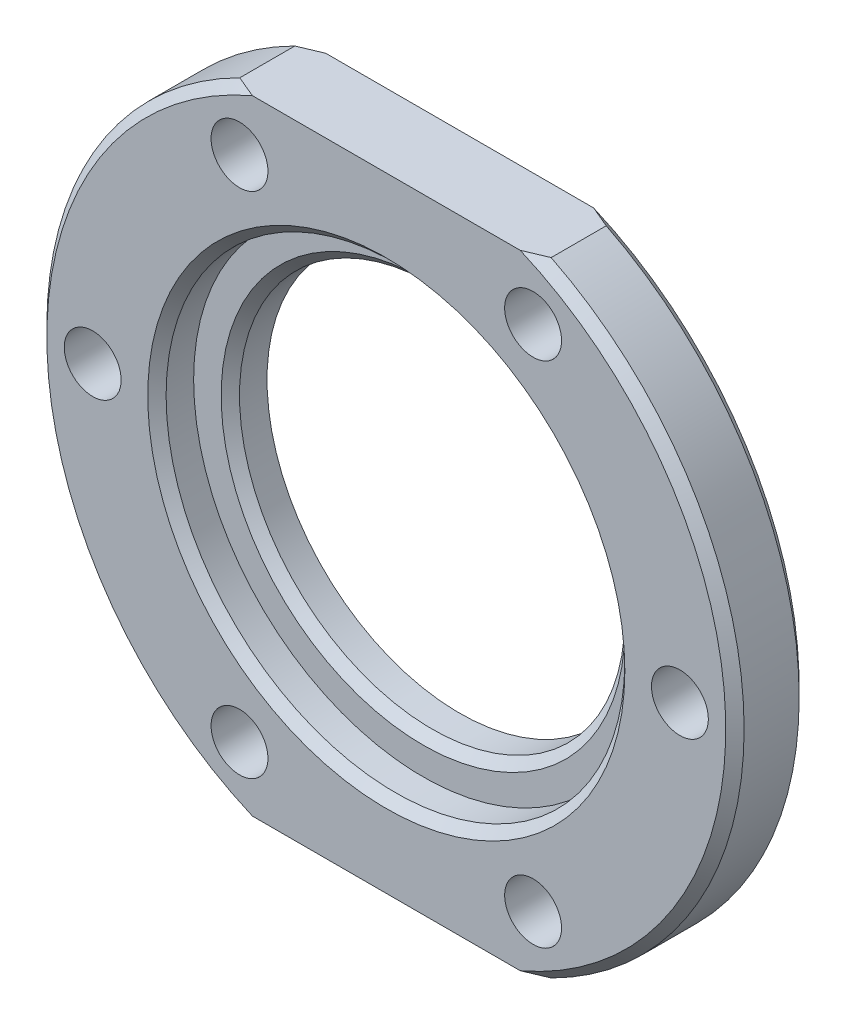
from build123d import *

# Parameters (mm, degrees)
BOSS_EXTRUDE1_DEPTH = 4
SKETCH2_R           = 12.5
CUT_EXTRUDE1_DEPTH  = 2
SKETCH3_R           = 10.5
CUT_EXTRUDE2_DEPTH  = 12
SKETCH4_R           = 1.55
CUT_EXTRUDE3_DEPTH  = 12
CHAMFER1_SIZE       = 0.5


with BuildPart() as part:
    # Sketch1 → Boss-Extrude1 (new body)
    with BuildSketch(Plane.XY):
        with BuildLine():
            Line((-8.485, 17), (8.485, 17))
            ThreePointArc((8.485, 17), (18.999874342, 0), (8.485, -17))
            Line((8.485, -17), (-8.485, -17))
            ThreePointArc((-8.485, -17), (-18.999874342, 0), (-8.485, 17))
        make_face()
    extrude(amount=BOSS_EXTRUDE1_DEPTH)

    # Sketch2 → Cut-Extrude1 (cut)
    with BuildSketch(Plane.XY.offset(4)):
        Circle(SKETCH2_R)
    extrude(amount=-CUT_EXTRUDE1_DEPTH, mode=Mode.SUBTRACT)

    # Sketch3 → Cut-Extrude2 (cut)
    with BuildSketch(Plane.XY.offset(2)):
        Circle(SKETCH3_R)
    extrude(amount=-CUT_EXTRUDE2_DEPTH, mode=Mode.SUBTRACT)

    # Sketch4 → Cut-Extrude3 (cut)
    with BuildSketch(Plane.XY.offset(4)):
        with Locations((-16, 0)):
            Circle(SKETCH4_R)
        with Locations((-8, 13.856406461)):
            Circle(SKETCH4_R)
        with Locations((8, 13.856406461)):
            Circle(SKETCH4_R)
        with Locations((16, 0)):
            Circle(SKETCH4_R)
        with Locations((8, -13.856406461)):
            Circle(SKETCH4_R)
        with Locations((-8, -13.856406461)):
            Circle(SKETCH4_R)
    extrude(amount=-CUT_EXTRUDE3_DEPTH, mode=Mode.SUBTRACT)

    # Chamfer1
    chamfer1_edges = [part.edges().sort_by_distance(p)[0] for p in [
        (18.999874342, 0, 0),
        (-18.999874342, 0, 4),
        (-10.5, 0, 2),
        (-12.5, 0, 4),
        (-18.999874342, 0, 0),
        (18.999874342, 0, 4),
    ]]
    chamfer(chamfer1_edges, length=CHAMFER1_SIZE)


solid = part.part
